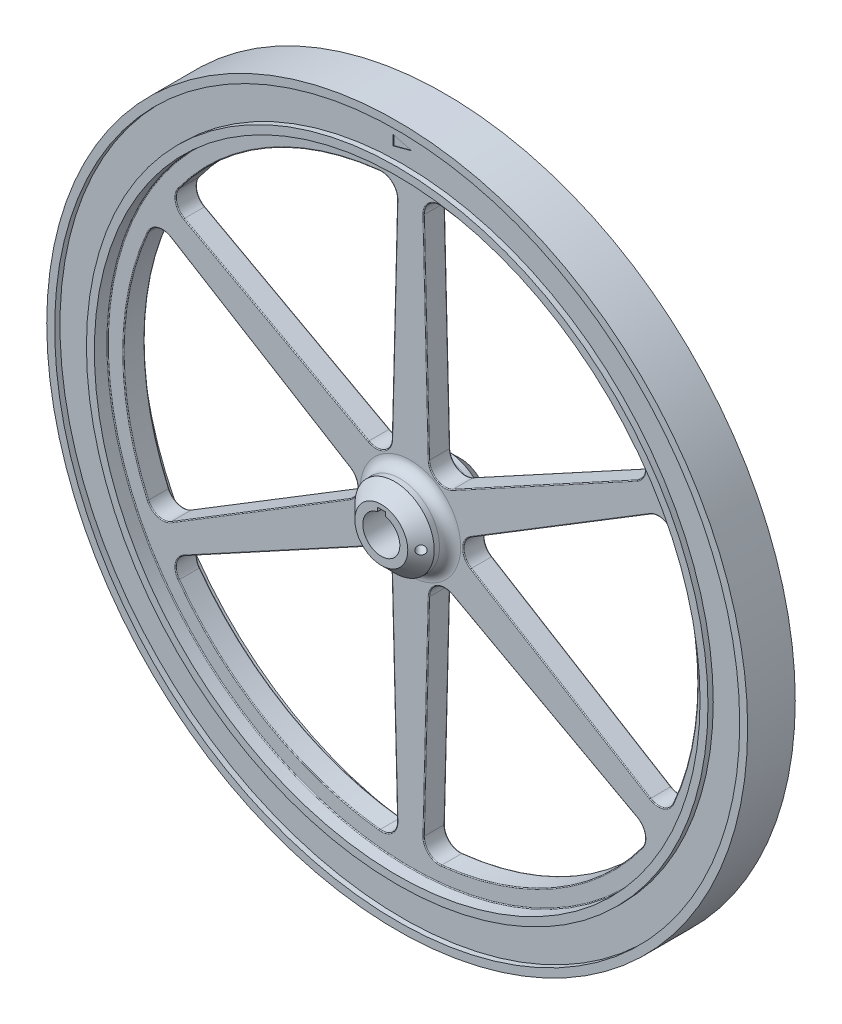
from build123d import *

# Parameters (mm, degrees)
SKETCH1_R                  = 114.5
BOSS_EXTRUDE1_DEPTH        = 4
SKETCH2_R                  = 15
BOSS_EXTRUDE2_DEPTH        = 15
SKETCH4_R                  = 132.5
SKETCH4_R_2                = 114.5
BOSS_EXTRUDE3_DEPTH        = 9
SKETCH6_R                  = 129.5
SKETCH6_R_2                = 117.5
CUT_EXTRUDE1_DEPTH         = 2
CHAMFER1_SIZE              = 5
CUT_EXTRUDE2_REACH         = 191.77
SKETCH7_R                  = 7
CUT_EXTRUDE3_DEPTH         = 188.982711971
CIRPATTERN1_COUNT          = 6
FILLET1_R                  = 4
CUT_EXTRUDE4_DEPTH         = 188.982711971
CUT_EXTRUDE4_DEPTH_BACK    = 188.982711971
FILLET2_R                  = 0.3
M4X0_7_TAPPED_HOLE2_REACH  = 200.337
M4X0_7_TAPPED_HOLE2_BORE_R = 1.65
M4X0_7_TAPPED_HOLE6_REACH  = 200.337
M4X0_7_TAPPED_HOLE6_BORE_R = 1.65
CUT_EXTRUDE5_DEPTH         = 0.2


with BuildPart() as part:
    # Sketch1 → Boss-Extrude1 (new, symmetric)
    with BuildSketch(Plane.XY):
        Circle(SKETCH1_R)
    extrude(amount=BOSS_EXTRUDE1_DEPTH, both=True)

    # Sketch2 → Boss-Extrude2 (add, symmetric)
    with BuildSketch(Plane.XY):
        Circle(SKETCH2_R)
    extrude(amount=BOSS_EXTRUDE2_DEPTH, both=True)

    # Sketch4 → Boss-Extrude3 (add, symmetric)
    with BuildSketch(Plane.XY):
        Circle(SKETCH4_R)
        Circle(SKETCH4_R_2, mode=Mode.SUBTRACT)
    extrude(amount=BOSS_EXTRUDE3_DEPTH, both=True)

    # Sketch6 → Cut-Extrude1 (cut)
    with BuildSketch(Plane.XY.offset(9)):
        Circle(SKETCH6_R)
        Circle(SKETCH6_R_2, mode=Mode.SUBTRACT)
    cut_extrude1 = extrude(amount=-CUT_EXTRUDE1_DEPTH, mode=Mode.SUBTRACT)

    # Mirror1: Cut-Extrude1 across plane
    add(cut_extrude1.mirror(Plane.XY), mode=Mode.SUBTRACT)

    # Chamfer1
    chamfer1_edges = [part.edges().sort_by_distance(p)[0] for p in [
        (-15, 0, -15),
        (-15, 0, 15),
    ]]
    chamfer(chamfer1_edges, length=CHAMFER1_SIZE)

    # Sketch7 → Cut-Extrude2 (cut, up to next)
    with BuildSketch(Plane.XY.offset(15), mode=Mode.PRIVATE) as cut_extrude2_sk1:
        Circle(SKETCH7_R)
    cut_extrude2_tool1 = extrude(cut_extrude2_sk1.sketch, amount=-CUT_EXTRUDE2_REACH, mode=Mode.PRIVATE) & part.part
    add(cut_extrude2_tool1.solids().sort_by_distance((0, 0, 15))[0], mode=Mode.SUBTRACT)

    # Sketch8 → Cut-Extrude3 (cut, symmetric)
    with BuildSketch(Plane.XY):
        with BuildLine():
            Line((7.001902952, 22.365558538), (5.001902952, 101.756944827))
            ThreePointArc((5.001902952, 101.756944827), (6.935569743, 106.321708157), (11.643902439, 107.873395868))
            ThreePointArc((11.643902439, 107.873395868), (54.25, 93.963756311), (87.599149994, 64.020613245))
            ThreePointArc((87.599149994, 64.020613245), (88.609515366, 59.167233666), (85.623147756, 55.210247437))
            Line((85.623147756, 55.210247437), (15.868190388, 17.2466051))
            ThreePointArc((15.868190388, 17.2466051), (10, 17.320508076), (7.001902952, 22.365558538))
        make_face()
    cut_extrude3 = extrude(amount=CUT_EXTRUDE3_DEPTH, both=True, mode=Mode.SUBTRACT)

    # CirPattern1: Cut-Extrude3 ×6 about axis
    cirpattern1_axis = Axis((0, 0, 0), (0, 0, 1))
    for i in range(1, CIRPATTERN1_COUNT):
        add(cut_extrude3.rotate(cirpattern1_axis, i * 360 / CIRPATTERN1_COUNT), mode=Mode.SUBTRACT)

    # Fillet1
    fillet1_edges = [part.edges().sort_by_distance(p)[0] for p in [
        (-15, 0, -4),
        (-15, 0, 4),
    ]]
    fillet(fillet1_edges, radius=FILLET1_R)

    # Sketch9 → Cut-Extrude4 (cut, two sides: drawn at the far end of the back side and taken through both)
    with BuildSketch(Plane.XY.offset(-CUT_EXTRUDE4_DEPTH_BACK)):
        with BuildLine():
            Line((-1.5, 6.837397166), (-1.5, 8.337397166))
            Line((-1.5, 8.337397166), (1.5, 8.337397166))
            Line((1.5, 8.337397166), (1.5, 6.837397166))
            ThreePointArc((1.5, 6.837397166), (0, 7), (-1.5, 6.837397166))
        make_face()
    extrude(amount=CUT_EXTRUDE4_DEPTH + CUT_EXTRUDE4_DEPTH_BACK, mode=Mode.SUBTRACT)

    # Fillet2
    fillet2_edges = [part.edges().sort_by_distance(p)[0] for p in [
        (-95.54508511, 47.154474491, -4),
        (-108.5, 0, -4),
        (-95.54508511, -47.154474491, -4),
        (-56.747572024, -25.832825414, -4),
        (-20, 0, -4),
        (-6.001902952, 62.061251683, -4),
        (-6.935569743, 106.321708157, -4),
        (-54.25, 93.963756311, -4),
        (-88.609515366, 59.167233666, -4),
        (-50.745669072, 36.228426269, -4),
        (-10, 17.320508076, -4),
        (-50.745669072, -36.228426269, -4),
        (-88.609515366, -59.167233666, -4),
        (-54.25, -93.963756311, -4),
        (-6.935569743, -106.321708157, -4),
        (-6.001902952, -62.061251683, -4),
        (-10, -17.320508076, -4),
        (6.001902952, -62.061251683, -4),
        (6.935569743, -106.321708157, -4),
        (54.25, -93.963756311, -4),
        (88.609515366, -59.167233666, -4),
        (50.745669072, -36.228426269, -4),
        (10, -17.320508076, -4),
        (10, -17.320508076, 4),
        (50.745669072, -36.228426269, 4),
        (88.609515366, -59.167233666, 4),
        (54.25, -93.963756311, 4),
        (6.935569743, -106.321708157, 4),
        (6.001902952, -62.061251683, 4),
        (-10, -17.320508076, 4),
        (-6.001902952, -62.061251683, 4),
        (-6.935569743, -106.321708157, 4),
        (-54.25, -93.963756311, 4),
        (-88.609515366, -59.167233666, 4),
        (-50.745669072, -36.228426269, 4),
        (-10, 17.320508076, 4),
        (-50.745669072, 36.228426269, 4),
        (-88.609515366, 59.167233666, 4),
        (-54.25, 93.963756311, 4),
        (-6.935569743, 106.321708157, 4),
        (-6.001902952, 62.061251683, 4),
        (-114.5, 0, 4),
        (-20, 0, 4),
        (-56.747572024, -25.832825414, 4),
        (-95.54508511, -47.154474491, 4),
        (-108.5, 0, 4),
        (-95.54508511, 47.154474491, 4),
        (-56.747572024, 25.832825414, 4),
        (20, 0, 4),
        (56.747572024, 25.832825414, 4),
        (95.54508511, 47.154474491, 4),
        (108.5, 0, 4),
        (95.54508511, -47.154474491, 4),
        (56.747572024, -25.832825414, 4),
        (-114.5, 0, -4),
        (50.745669072, 36.228426269, -4),
        (88.609515366, 59.167233666, -4),
        (54.25, 93.963756311, -4),
        (6.935569743, 106.321708157, -4),
        (6.001902952, 62.061251683, -4),
        (10, 17.320508076, -4),
        (10, 17.320508076, 4),
        (6.001902952, 62.061251683, 4),
        (6.935569743, 106.321708157, 4),
        (54.25, 93.963756311, 4),
        (88.609515366, 59.167233666, 4),
        (50.745669072, 36.228426269, 4),
        (56.747572024, -25.832825414, -4),
        (95.54508511, -47.154474491, -4),
        (108.5, 0, -4),
        (95.54508511, 47.154474491, -4),
        (56.747572024, 25.832825414, -4),
        (20, 0, -4),
        (-56.747572024, 25.832825414, -4),
    ]]
    fillet(fillet2_edges, radius=FILLET2_R)

    # M4x0.7 Tapped Hole2 bore → M4x0.7 Tapped Hole2 (cut, up to next)
    with BuildSketch(Plane(origin=(12.499622471, 0, 12.500377529), x_dir=(0.7071067811865475, 0, -0.7071067811865477), z_dir=(0.7071067811865477, 0, 0.7071067811865475)), mode=Mode.PRIVATE) as m4x0_7_tapped_hole2_sk1:
        Circle(M4X0_7_TAPPED_HOLE2_BORE_R)
    m4x0_7_tapped_hole2_tool1 = extrude(m4x0_7_tapped_hole2_sk1.sketch, amount=-M4X0_7_TAPPED_HOLE2_REACH, mode=Mode.PRIVATE) & part.part
    add(m4x0_7_tapped_hole2_tool1.solids().sort_by_distance((12.499622, 0, 12.500378))[0], mode=Mode.SUBTRACT)

    # M4x0.7 Tapped Hole6 bore → M4x0.7 Tapped Hole6 (cut, up to next)
    with BuildSketch(Plane(origin=(12.500377529, 0, -12.499622471), x_dir=(0.7071067811865475, 0, 0.7071067811865476), z_dir=(0.7071067811865476, 0, -0.7071067811865475)), mode=Mode.PRIVATE) as m4x0_7_tapped_hole6_sk1:
        Circle(M4X0_7_TAPPED_HOLE6_BORE_R)
    m4x0_7_tapped_hole6_tool1 = extrude(m4x0_7_tapped_hole6_sk1.sketch, amount=-M4X0_7_TAPPED_HOLE6_REACH, mode=Mode.PRIVATE) & part.part
    add(m4x0_7_tapped_hole6_tool1.solids().sort_by_distance((12.500378, 0, -12.499622))[0], mode=Mode.SUBTRACT)

    # Sketch22 → Cut-Extrude5 (cut)
    with BuildSketch(Plane.XY.offset(7)):
        Polygon((3.5, 123.5), (-3.5, 125.375644347), (-3.5, 121.624355653), align=None)
    cut_extrude5 = extrude(amount=-CUT_EXTRUDE5_DEPTH, mode=Mode.SUBTRACT)

    # Mirror4: Cut-Extrude5 across plane
    add(cut_extrude5.mirror(Plane.XY), mode=Mode.SUBTRACT)


solid = part.part
